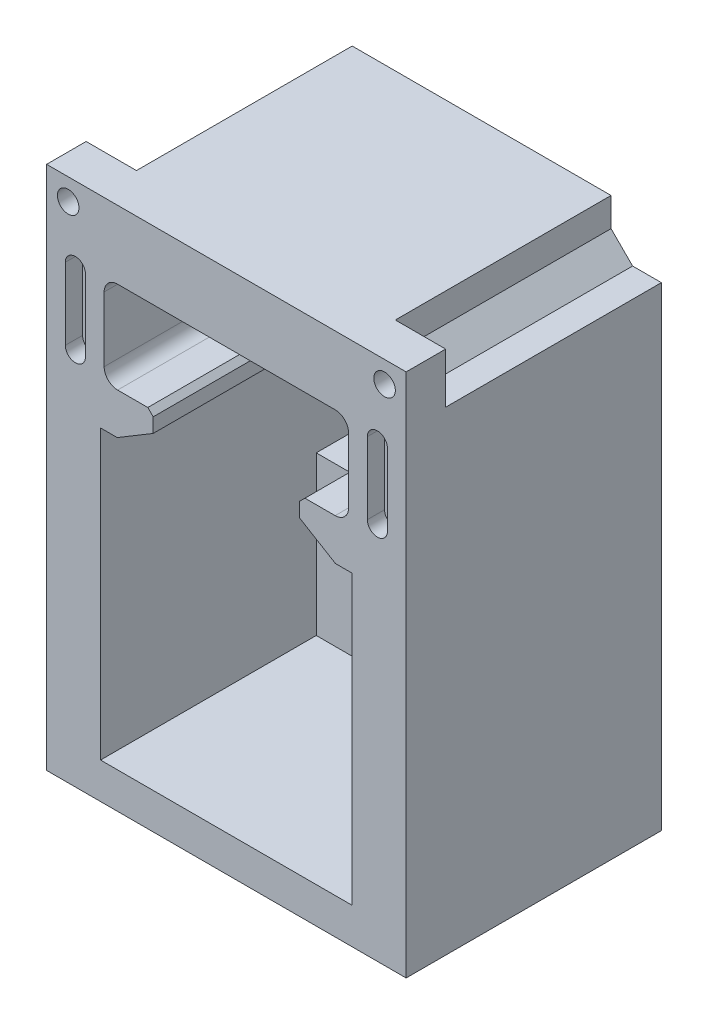
from build123d import *

# Parameters (mm, degrees)
BOSS_EXTRU_1_DEPTH      = 20
CONG_1_R                = 2.38125
ESQUISSE2_W             = 63.5
ESQUISSE2_H             = 35.56
BOSS_EXTRU_2_DEPTH      = 5.08
EMPREINTE1_START        = -25.08
EMPREINTE1_DEPTH        = 5.08
D_PLACER_START          = -25.08
D_PLACER_LA_FACE1_DEPTH = 5.08
EMPREINTE4_START        = 17.46
EMPREINTE4_DEPTH        = 2.54
D_PLACER_START_2        = 16.952
D_PLACER_LA_FACE2_DEPTH = 3.048
CHANFREIN1_SIZE         = 6.35
CHANFREIN1_SIZE2        = 3.81
CHANFREIN2_SIZE         = 3.81
CHANFREIN2_SIZE2        = 6.35
BOSS_EXTRU_3_DEPTH      = 45.08
ESQUISSE4_W             = 44.45
ESQUISSE4_H             = 27.94
ENL_V_MAT_EXTRU_1_DEPTH = 38.1
ESQUISSE5_W             = 12.7
ESQUISSE5_H             = 3.81
BOSS_EXTRU_4_DEPTH      = 12.7
CONG_2_R                = 2.54
D_GAGEMENT_61_D         = 3.7973
ENL_V_MAT_EXTRU_2_DEPTH = 38.1
D_GAGEMENT_62_D         = 3.7973
D_GAGEMENT_62_DEPTH     = 18.796
D_GAGEMENT_62_TIP       = 1.140824014


# Read off the part's stored shape, not the designer's step: Empreinte1, Déplacer la face1, Empreinte4, Déplacer la face2
with BuildPart() as part:
    # Esquisse1 → Boss.-Extru.1 (new, symmetric)
    with BuildSketch(Plane.XY):
        Polygon((-31.75, -1.905), (-31.75, 33.655), (31.75, 33.655), (31.75, -1.905), (12.92225, -1.905), (12.92225, 4.445), (13.87475, 5.3975), (21.59, 5.3975), (21.59, 21.59), (-21.59, 21.59), (-21.59, 5.3975), (-13.87475, 5.3975), (-12.92225, 4.445), (-12.92225, -1.905), align=None)
    extrude(amount=BOSS_EXTRU_1_DEPTH, both=True)

    # Congé1
    cong_1_edges = [part.edges().sort_by_distance(p)[0] for p in [
        (21.59, 5.3975, 0),
        (21.59, 21.59, 0),
        (-21.59, 21.59, 0),
        (-21.59, 5.3975, 0),
    ]]
    fillet(cong_1_edges, radius=CONG_1_R)

    # Esquisse2 → Boss.-Extru.2 (add)
    with BuildSketch(Plane(origin=(0, 0, -20), x_dir=(-1, 0, 0), z_dir=(0, 0, -1))):
        with Locations((0, 15.875)):
            Rectangle(ESQUISSE2_W, ESQUISSE2_H)
    extrude(amount=BOSS_EXTRU_2_DEPTH)

    # Empreinte1 outline → Empreinte1 (cut)
    with BuildSketch(Plane.XY.offset(EMPREINTE1_START)):
        with BuildLine():
            Line((14.44625, 7.9375), (16.66875, 7.9375))
            ThreePointArc((16.66875, 7.9375), (17.366201977, 9.621298023), (19.05, 10.31875))
            Line((19.05, 10.31875), (19.05, 16.66875))
            ThreePointArc((19.05, 16.66875), (17.366201977, 17.366201977), (16.66875, 19.05))
            Line((16.66875, 19.05), (-16.66875, 19.05))
            ThreePointArc((-16.66875, 19.05), (-17.366201977, 17.366201977), (-19.05, 16.66875))
            Line((-19.05, 16.66875), (-19.05, 10.31875))
            ThreePointArc((-19.05, 10.31875), (-17.366201977, 9.621298023), (-16.66875, 7.9375))
            Line((-16.66875, 7.9375), (-14.44625, 7.9375))
            Line((-14.44625, 7.9375), (-11.90625, 5.3975))
            Line((-11.90625, 5.3975), (-11.90625, -1.905))
            Line((-11.90625, -1.905), (11.90625, -1.905))
            Line((11.90625, -1.905), (11.90625, 5.3975))
            Line((11.90625, 5.3975), (14.44625, 7.9375))
        make_face()
    extrude(amount=EMPREINTE1_DEPTH, mode=Mode.SUBTRACT)

    # Déplacer la face1 outline → Déplacer la face1 (cut)
    with BuildSketch(Plane.XY.offset(D_PLACER_START)):
        with BuildLine():
            Line((-14.867090979, 6.9215), (-12.92225, 4.976659021))
            Line((-12.92225, 4.976659021), (-12.92225, -1.905))
            Line((-12.92225, -1.905), (-11.90625, -1.905))
            Line((-11.90625, -1.905), (-11.90625, 5.3975))
            Line((-11.90625, 5.3975), (-14.44625, 7.9375))
            Line((-14.44625, 7.9375), (-16.66875, 7.9375))
            ThreePointArc((-16.66875, 7.9375), (-17.366201977, 9.621298023), (-19.05, 10.31875))
            Line((-19.05, 10.31875), (-19.05, 16.66875))
            ThreePointArc((-19.05, 16.66875), (-17.366201977, 17.366201977), (-16.66875, 19.05))
            Line((-16.66875, 19.05), (16.66875, 19.05))
            ThreePointArc((16.66875, 19.05), (17.366201977, 17.366201977), (19.05, 16.66875))
            Line((19.05, 16.66875), (19.05, 10.31875))
            ThreePointArc((19.05, 10.31875), (17.366201977, 9.621298023), (16.66875, 7.9375))
            Line((16.66875, 7.9375), (14.44625, 7.9375))
            Line((14.44625, 7.9375), (11.90625, 5.3975))
            Line((11.90625, 5.3975), (11.90625, -1.905))
            Line((11.90625, -1.905), (12.92225, -1.905))
            Line((12.92225, -1.905), (12.92225, 4.976659021))
            Line((12.92225, 4.976659021), (14.867090979, 6.9215))
            Line((14.867090979, 6.9215), (18.13805068, 6.9215))
            ThreePointArc((18.13805068, 6.9215), (18.084622467, 8.902877533), (20.066, 8.84944932))
            Line((20.066, 8.84944932), (20.066, 18.13805068))
            ThreePointArc((20.066, 18.13805068), (18.084622467, 18.084622467), (18.13805068, 20.066))
            Line((18.13805068, 20.066), (-18.13805068, 20.066))
            ThreePointArc((-18.13805068, 20.066), (-18.084622467, 18.084622467), (-20.066, 18.13805068))
            Line((-20.066, 18.13805068), (-20.066, 8.84944932))
            ThreePointArc((-20.066, 8.84944932), (-18.084622467, 8.902877533), (-18.13805068, 6.9215))
            Line((-18.13805068, 6.9215), (-14.867090979, 6.9215))
        make_face()
    extrude(amount=D_PLACER_LA_FACE1_DEPTH, mode=Mode.SUBTRACT)

    # Empreinte4 outline → Empreinte4 (cut)
    with BuildSketch(Plane.XY.offset(EMPREINTE4_START)):
        with BuildLine():
            ThreePointArc((-27.94, 7.62), (-26.67, 6.35), (-25.4, 7.62))
            Line((-25.4, 7.62), (-25.4, 20.32))
            ThreePointArc((-25.4, 20.32), (-26.67, 21.59), (-27.94, 20.32))
            Line((-27.94, 20.32), (-27.94, 7.62))
        make_face()
        with BuildLine():
            Line((25.4, 20.32), (25.4, 7.62))
            ThreePointArc((25.4, 7.62), (26.67, 6.35), (27.94, 7.62))
            Line((27.94, 7.62), (27.94, 20.32))
            ThreePointArc((27.94, 20.32), (26.67, 21.59), (25.4, 20.32))
        make_face()
    extrude(amount=EMPREINTE4_DEPTH, mode=Mode.SUBTRACT)

    # Déplacer la face2 outline → Déplacer la face2 (cut)
    with BuildSketch(Plane.XY.offset(D_PLACER_START_2)):
        with BuildLine():
            ThreePointArc((-28.448, 7.62), (-26.67, 5.842), (-24.892, 7.62))
            Line((-24.892, 7.62), (-24.892, 20.32))
            ThreePointArc((-24.892, 20.32), (-26.67, 22.098), (-28.448, 20.32))
            Line((-28.448, 20.32), (-28.448, 7.62))
        make_face()
        with BuildLine():
            Line((24.892, 20.32), (24.892, 7.62))
            ThreePointArc((24.892, 7.62), (26.67, 5.842), (28.448, 7.62))
            Line((28.448, 7.62), (28.448, 20.32))
            ThreePointArc((28.448, 20.32), (26.67, 22.098), (24.892, 20.32))
        make_face()
    extrude(amount=D_PLACER_LA_FACE2_DEPTH, mode=Mode.SUBTRACT)

    # Chanfrein1
    chanfrein1_edges = [part.edges().sort_by_distance(p)[0] for p in [
        (-12.92225, -1.905, -2.54),
    ]]
    chanfrein1_side = [part.faces().sort_by_distance(p)[0] for p in [
        (-22.336125, -1.905, -2.54),
    ]]
    chamfer(chanfrein1_edges, length=CHANFREIN1_SIZE, length2=CHANFREIN1_SIZE2, reference=chanfrein1_side[0])

    # Chanfrein2
    chanfrein2_edges = [part.edges().sort_by_distance(p)[0] for p in [
        (12.92225, -1.905, -2.54),
    ]]
    chanfrein2_side = [part.faces().sort_by_distance(p)[0] for p in [
        (12.92225, 1.302160596, -2.726935132),
    ]]
    chamfer(chanfrein2_edges, length=CHANFREIN2_SIZE, length2=CHANFREIN2_SIZE2, reference=chanfrein2_side[0])

    # Esquisse3 → Boss.-Extru.3 (add)
    with BuildSketch(Plane.XY.offset(20)):
        Polygon((-31.75, -1.905), (-31.75, -59.055), (31.75, -59.055), (31.75, -1.905), (22.225, -1.905), (22.225, -24.765), (-22.225, -24.765), (-22.225, -1.905), align=None)
    extrude(amount=-BOSS_EXTRU_3_DEPTH)

    # Esquisse4 → Enlèv. mat.-Extru.1 (cut)
    with BuildSketch(Plane.XY.offset(20)):
        with Locations((0, -38.735)):
            Rectangle(ESQUISSE4_W, ESQUISSE4_H)
    extrude(amount=-ENL_V_MAT_EXTRU_1_DEPTH, mode=Mode.SUBTRACT)

    # Esquisse5 → Boss.-Extru.4 (add)
    with BuildSketch(Plane(origin=(0, 0, -25.08), x_dir=(-1, 0, 0), z_dir=(0, 0, -1))):
        with Locations((0, -54.522979854)):
            Rectangle(ESQUISSE5_W, ESQUISSE5_H)
    extrude(amount=BOSS_EXTRU_4_DEPTH)

    # Congé2
    cong_2_edges = [part.edges().sort_by_distance(p)[0] for p in [
        (6.35, -54.522979854, -37.78),
        (-6.35, -54.522979854, -37.78),
    ]]
    fillet(cong_2_edges, radius=CONG_2_R)

    # Dégagement #61 (through all)
    with Locations(Plane(origin=(0, -52.617979854, 0), x_dir=(1, 0, 0), z_dir=(0, 1, 0))):
        with Locations((0, 31.43)):
            Hole(D_GAGEMENT_61_D / 2)

    # Esquisse8 → Enlèv. mat.-Extru.2 (cut)
    with BuildSketch(Plane(origin=(0, 0, -25.08), x_dir=(-1, 0, 0), z_dir=(0, 0, -1))):
        Polygon((22.86, 33.655), (31.75, 33.655), (31.75, 24.765), (26.67, 24.765), (22.86, 28.575), align=None)
    enl_v_mat_extru_2 = extrude(amount=-ENL_V_MAT_EXTRU_2_DEPTH, mode=Mode.SUBTRACT)

    # Symétrie1: Enlèv. mat.-Extru.2 across plane
    add(enl_v_mat_extru_2.mirror(Plane(origin=(0, 0, 0), x_dir=(0, 0, 1), z_dir=(1, 0, 0))), mode=Mode.SUBTRACT)

    # Dégagement #62
    with Locations(Plane(origin=(0, 0, 13.02), x_dir=(-1, 0, 0), z_dir=(0, 0, -1))):
        with Locations((27.94, 29.845), (-27.94, 29.845)):
            Hole(D_GAGEMENT_62_D / 2, depth=D_GAGEMENT_62_DEPTH)
            with Locations((0, 0, -(D_GAGEMENT_62_DEPTH + D_GAGEMENT_62_TIP / 2))):  # 118° drill point
                Cone(0, D_GAGEMENT_62_D / 2, D_GAGEMENT_62_TIP, mode=Mode.SUBTRACT)


solid = part.part
